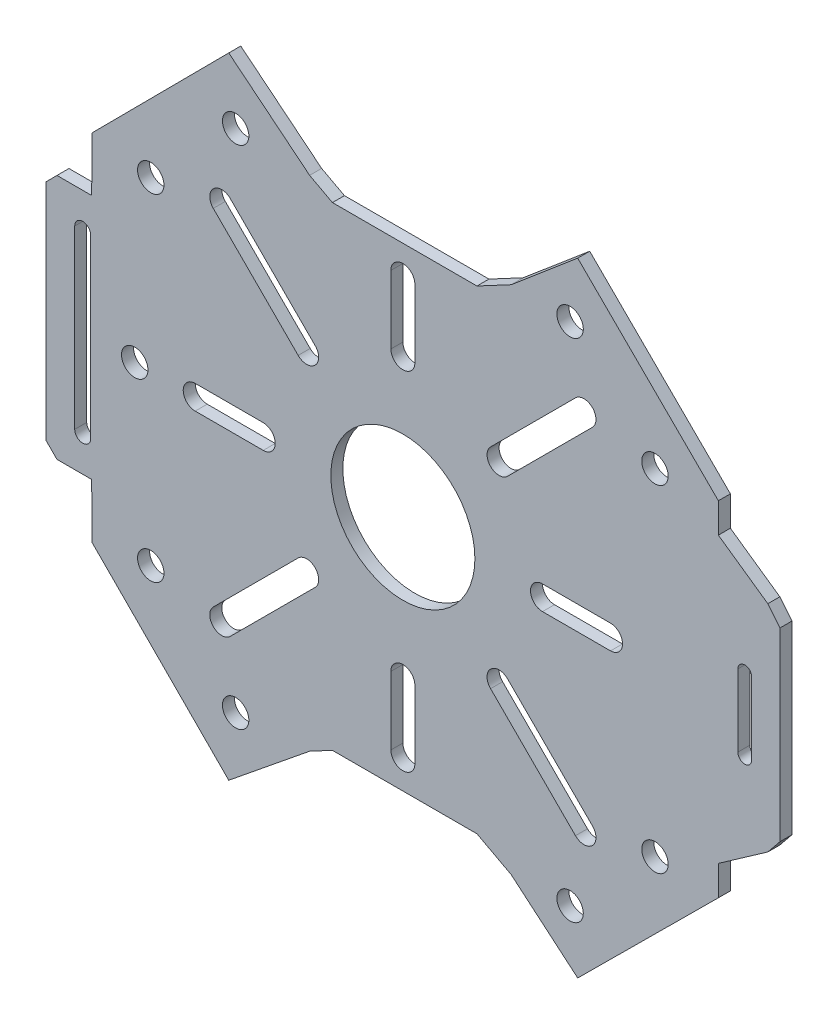
from build123d import *

# Parameters (mm, degrees)
UPPER_BOARD_R   = 9
UPPER_BOARD_R_2 = 1.65
EXTRUDE_1_DEPTH = 1.5


with BuildPart() as part:
    # Upper_board → 凸台-拉伸1 (new body)
    with BuildSketch(Plane.XY):
        Polygon((0, 29.63770528), (9.258229776, 29.63770528), (13.530145247, 31.914413679), (21.845237215, 38.947274579), (39.422116781, 21.483203913), (39.422116781, 17.759375685), (45.602672711, 13.431703833), (47.117107925, 11.564161962), (47.117107925, -11.564161962), (45.602672711, -13.431703833), (39.422116781, -17.759375685), (39.422116781, -21.483203913), (21.845237215, -38.947274579), (13.530145247, -31.914413679), (9.258229776, -29.63770528), (0, -29.63770528), (-8.800437365, -29.63770528), (-11.64882797, -31.155749084), (-21.754927214, -39.351031245), (-38.850540354, -22.144989251), (-38.878084859, -15.364158174), (-43.219581062, -15.364158174), (-44.585312397, -13.989604918), (-44.585312397, 13.989604918), (-43.219581062, 15.364158174), (-38.878084859, 15.364158174), (-38.850540354, 22.144989251), (-21.754927214, 39.351031245), (-11.64882797, 31.155749084), (-8.800437365, 29.63770528), align=None)
        Circle(UPPER_BOARD_R, mode=Mode.SUBTRACT)
        with Locations((-20.893398282, 31.606601718)):
            Circle(UPPER_BOARD_R_2, mode=Mode.SUBTRACT)
        with Locations((-31.5, 21)):
            Circle(UPPER_BOARD_R_2, mode=Mode.SUBTRACT)
        with Locations((-33.5, 0)):
            Circle(UPPER_BOARD_R_2, mode=Mode.SUBTRACT)
        with Locations((20.893398282, 31.606601718)):
            Circle(UPPER_BOARD_R_2, mode=Mode.SUBTRACT)
        with Locations((31.5, 21)):
            Circle(UPPER_BOARD_R_2, mode=Mode.SUBTRACT)
        with Locations((-20.893398282, -31.606601718)):
            Circle(UPPER_BOARD_R_2, mode=Mode.SUBTRACT)
        with Locations((-31.5, -21)):
            Circle(UPPER_BOARD_R_2, mode=Mode.SUBTRACT)
        with Locations((20.893398282, -31.606601718)):
            Circle(UPPER_BOARD_R_2, mode=Mode.SUBTRACT)
        with Locations((31.5, -21)):
            Circle(UPPER_BOARD_R_2, mode=Mode.SUBTRACT)
        with BuildLine():
            Line((-21.566327477, 23.687647821), (-10.960584458, 13.081904801))
            ThreePointArc((-10.960584458, 13.081904801), (-10.960584458, 10.960584458), (-13.081904801, 10.960584458))
            Line((-13.081904801, 10.960584458), (-23.687647821, 21.566327477))
            ThreePointArc((-23.687647821, 21.566327477), (-23.687647821, 23.687647821), (-21.566327477, 23.687647821))
        make_face(mode=Mode.SUBTRACT)
        with BuildLine():
            Line((-1.5, 17.445654013), (-1.5, 25.945654013))
            ThreePointArc((-1.5, 25.945654013), (0, 27.445654013), (1.5, 25.945654013))
            Line((1.5, 25.945654013), (1.5, 17.445654013))
            ThreePointArc((1.5, 17.445654013), (0, 15.945654013), (-1.5, 17.445654013))
        make_face(mode=Mode.SUBTRACT)
        with BuildLine():
            Line((-1.5, -17.445654013), (-1.5, -25.945654013))
            ThreePointArc((-1.5, -25.945654013), (0, -27.445654013), (1.5, -25.945654013))
            Line((1.5, -25.945654013), (1.5, -17.445654013))
            ThreePointArc((1.5, -17.445654013), (0, -15.945654013), (-1.5, -17.445654013))
        make_face(mode=Mode.SUBTRACT)
        with BuildLine():
            Line((-17.445654013, 1.5), (-25.945654013, 1.5))
            ThreePointArc((-25.945654013, 1.5), (-27.445654013, 0), (-25.945654013, -1.5))
            Line((-25.945654013, -1.5), (-17.445654013, -1.5))
            ThreePointArc((-17.445654013, -1.5), (-15.945654013, 0), (-17.445654013, 1.5))
        make_face(mode=Mode.SUBTRACT)
        with BuildLine():
            Line((17.445654013, 1.5), (25.945654013, 1.5))
            ThreePointArc((25.945654013, 1.5), (27.445654013, 0), (25.945654013, -1.5))
            Line((25.945654013, -1.5), (17.445654013, -1.5))
            ThreePointArc((17.445654013, -1.5), (15.945654013, 0), (17.445654013, 1.5))
        make_face(mode=Mode.SUBTRACT)
        with BuildLine():
            Line((-21.566327477, -23.687647821), (-10.960584458, -13.081904801))
            ThreePointArc((-10.960584458, -13.081904801), (-10.960584458, -10.960584458), (-13.081904801, -10.960584458))
            Line((-13.081904801, -10.960584458), (-23.687647821, -21.566327477))
            ThreePointArc((-23.687647821, -21.566327477), (-23.687647821, -23.687647821), (-21.566327477, -23.687647821))
        make_face(mode=Mode.SUBTRACT)
        with BuildLine():
            Line((21.566327477, 23.687647821), (10.960584458, 13.081904801))
            ThreePointArc((10.960584458, 13.081904801), (10.960584458, 10.960584458), (13.081904801, 10.960584458))
            Line((13.081904801, 10.960584458), (23.687647821, 21.566327477))
            ThreePointArc((23.687647821, 21.566327477), (23.687647821, 23.687647821), (21.566327477, 23.687647821))
        make_face(mode=Mode.SUBTRACT)
        with BuildLine():
            Line((21.566327477, -23.687647821), (10.960584458, -13.081904801))
            ThreePointArc((10.960584458, -13.081904801), (10.960584458, -10.960584458), (13.081904801, -10.960584458))
            Line((13.081904801, -10.960584458), (23.687647821, -21.566327477))
            ThreePointArc((23.687647821, -21.566327477), (23.687647821, -23.687647821), (21.566327477, -23.687647821))
        make_face(mode=Mode.SUBTRACT)
        with BuildLine():
            Line((-41, -11), (-41, 11))
            ThreePointArc((-41, 11), (-40, 12), (-39, 11))
            Line((-39, 11), (-39, -11))
            ThreePointArc((-39, -11), (-40, -12), (-41, -11))
        make_face(mode=Mode.SUBTRACT)
        with BuildLine():
            Line((41.855351652, -4.5), (41.855351652, 4.5))
            ThreePointArc((41.855351652, 4.5), (42.721395453, 5.366043802), (43.587439255, 4.5))
            Line((43.587439255, 4.5), (43.587439255, -4.5))
            ThreePointArc((43.587439255, -4.5), (42.721395453, -5.366043802), (41.855351652, -4.5))
        make_face(mode=Mode.SUBTRACT)
    extrude(amount=EXTRUDE_1_DEPTH)


solid = part.part
